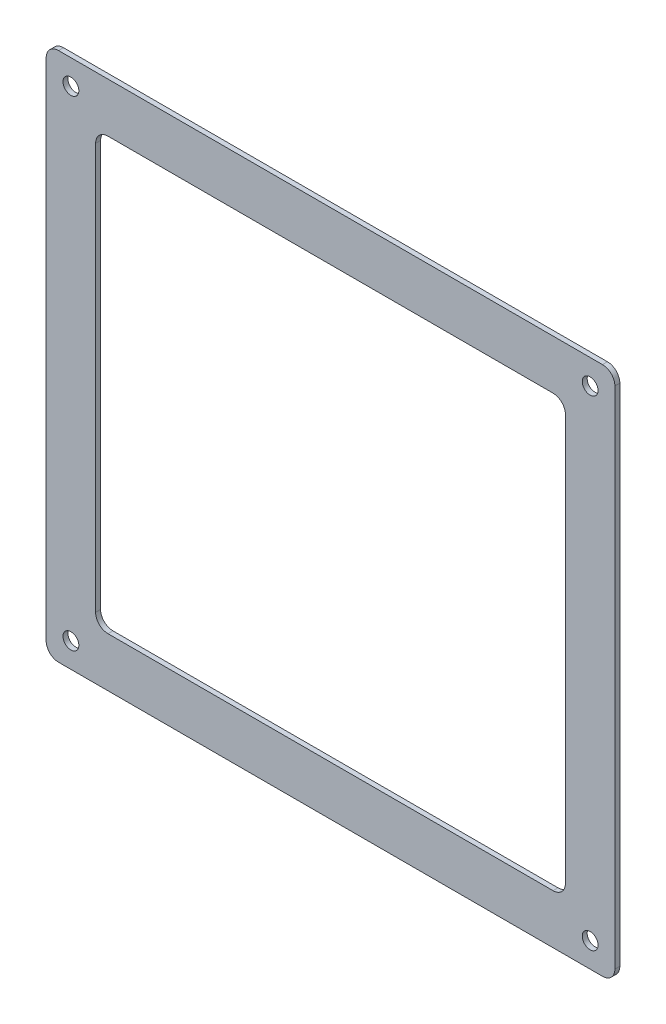
from build123d import *

# Parameters (mm, degrees)
SKETCH_1_W              = 230
SKETCH_1_H              = 214.25
SKETCH_1_W_2            = 190
SKETCH_1_H_2            = 174.25
EXTRUDE_1_DEPTH         = 2
FILLET_1_R              = 5
HOLE_WIZARD_6_4_6_4_1_D = 6.4


with BuildPart() as part:
    # 草图1 → 凸台-拉伸1 (new body)
    with BuildSketch(Plane.XY):
        Rectangle(SKETCH_1_W, SKETCH_1_H)
        Rectangle(SKETCH_1_W_2, SKETCH_1_H_2, mode=Mode.SUBTRACT)
    extrude(amount=EXTRUDE_1_DEPTH)

    # 圆角1
    fillet_1_edges = [part.edges().sort_by_distance(p)[0] for p in [
        (95, -87.125, 1),
        (95, 87.125, 1),
        (-115, -107.125, 1),
        (-95, -87.125, 1),
        (-115, 107.125, 1),
        (-95, 87.125, 1),
        (115, -107.125, 1),
        (115, 107.125, 1),
    ]]
    fillet(fillet_1_edges, radius=FILLET_1_R)

    # Ø6.4 (6.4) 直径孔1 (through all)
    with Locations(Plane.XY.offset(2)):
        with Locations((-105, 97.125), (-105, -97.125), (105, -97.125), (105, 97.125)):
            Hole(HOLE_WIZARD_6_4_6_4_1_D / 2)


solid = part.part
